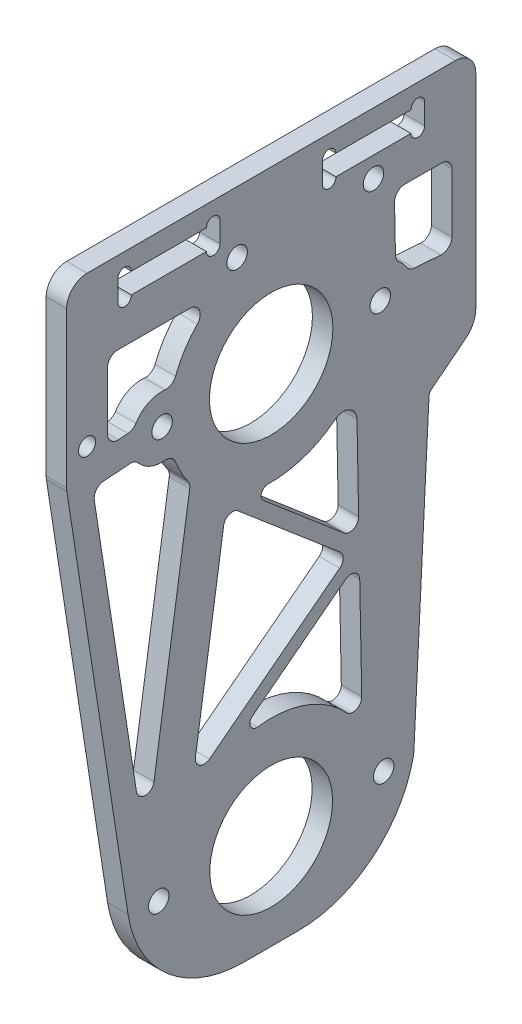
from build123d import *

# Parameters (mm, degrees)
SKETCH_1_W          = 60
SKETCH_1_H          = 96
SKETCH_1_R          = 1.5
SKETCH_1_R_2        = 9
SKETCH_1_R_3        = 9.05
SKETCH_1_H_2        = 3
EXTRUDE_1_DEPTH     = 3
CUT_EXTRUDE_START   = -3
CUT_EXTRUDE_1_DEPTH = 3
SKETCH_3_R          = 1.25
SKETCH_3_R_2        = 1.5
SKETCH_3_W          = 15
SKETCH_3_H          = 3
CUT_EXTRUDE_2_DEPTH = 60.245252974
SKETCH_4_R          = 1
CUT_EXTRUDE_3_DEPTH = 60.245252974
CUT_EXTRUDE_4_DEPTH = 10
CUT_EXTRUDE_5_DEPTH = 60.245252974
EXTRUDE_2_DEPTH     = 3
FILLET_1_R          = 1.3
FILLET_9_R          = 2
FILLET_3_R          = 3
FILLET_4_R          = 1.5
FILLET_5_R          = 4
CUT_EXTRUDE_6_DEPTH = 60.251242528
FILLET_6_R          = 1
FILLET_10_R         = 5


# Read off the part's stored shape, not the designer's step: 切除-拉伸1
with BuildPart() as part:
    # 草图1 → 凸台-拉伸1 (new body)
    # profile 1 of 2: a face of its own
    with BuildSketch(Plane(origin=(0, 0, 0), x_dir=(0, 0, -1), z_dir=(1, 0, 0))):
        Rectangle(SKETCH_1_W, SKETCH_1_H)
        with Locations((16.5, -34)):
            Circle(SKETCH_1_R, mode=Mode.SUBTRACT)
        with Locations((-16.5, -34)):
            Circle(SKETCH_1_R, mode=Mode.SUBTRACT)
        with Locations((16, 26)):
            Circle(SKETCH_1_R, mode=Mode.SUBTRACT)
        with Locations((-16, 26)):
            Circle(SKETCH_1_R, mode=Mode.SUBTRACT)
        with Locations((0, -34)):
            Circle(SKETCH_1_R_2, mode=Mode.SUBTRACT)
        with Locations((0, 26)):
            Circle(SKETCH_1_R_3, mode=Mode.SUBTRACT)
    # profile 2 of 2: a face of its own
    with BuildSketch(Plane(origin=(0, 0, 0), x_dir=(0, 0, -1), z_dir=(1, 0, 0))):
        with Locations((0, 49.5)):
            Rectangle(SKETCH_1_W, SKETCH_1_H_2)
    extrude(amount=EXTRUDE_1_DEPTH)

    # 切除-拉伸1 outline → 切除-拉伸1 (cut)
    with BuildSketch(Plane(origin=(3, 0, 0), x_dir=(0, 0, -1), z_dir=(1, 0, 0)).offset(CUT_EXTRUDE_START)):
        with BuildLine():
            Line((30, -48), (30, 25))
            Line((30, 25), (21, -33.41847233))
            ThreePointArc((21, -33.41847233), (15.198447986, -43.855245061), (4, -48))
            Line((4, -48), (30, -48))
        make_face()
        with BuildLine():
            Line((-30, -48), (-4, -48))
            ThreePointArc((-4, -48), (-15.198447986, -43.855245061), (-21, -33.41847233))
            Line((-21, -33.41847233), (-30, 25))
            Line((-30, 25), (-30, -48))
        make_face()
    extrude(amount=CUT_EXTRUDE_1_DEPTH, mode=Mode.SUBTRACT)

    # 草图3 → 切除-拉伸2 (cut, through all)
    with BuildSketch(Plane(origin=(3, 0, 0), x_dir=(0, 0, -1), z_dir=(1, 0, 0))):
        with Locations((-27, 29)):
            Circle(SKETCH_3_R)
        with Locations((15, 42)):
            Circle(SKETCH_3_R_2)
        with Locations((-5, 42)):
            Circle(SKETCH_3_R_2)
        with Locations((-15, 46.5)):
            Rectangle(SKETCH_3_W, SKETCH_3_H)
        with Locations((15, 46.5)):
            Rectangle(SKETCH_3_W, SKETCH_3_H)
    extrude(amount=-CUT_EXTRUDE_2_DEPTH, mode=Mode.SUBTRACT)

    # 草图4 → 切除-拉伸3 (cut, through all)
    with BuildSketch(Plane(origin=(3, 0, 0), x_dir=(0, 0, -1), z_dir=(1, 0, 0))):
        with Locations((-21.5, 48)):
            Circle(SKETCH_4_R)
        with Locations((-21.5, 45)):
            Circle(SKETCH_4_R)
        with Locations((-8.5, 48)):
            Circle(SKETCH_4_R)
        with Locations((-8.5, 45)):
            Circle(SKETCH_4_R)
        with Locations((8.5, 45)):
            Circle(SKETCH_4_R)
        with Locations((8.5, 48)):
            Circle(SKETCH_4_R)
        with Locations((21.5, 45)):
            Circle(SKETCH_4_R)
        with Locations((21.5, 48)):
            Circle(SKETCH_4_R)
    extrude(amount=-CUT_EXTRUDE_3_DEPTH, mode=Mode.SUBTRACT)

    # 草图6 → 切除-拉伸4 (cut)
    with BuildSketch(Plane(origin=(3, 0, 0), x_dir=(0, 0, -1), z_dir=(1, 0, 0))):
        with BuildLine():
            Line((-18.4613646, -26.910285625), (-11.857625415, 16.731816817))
            ThreePointArc((-11.857625415, 16.731816817), (-13.391258067, 19.13146978), (-14.445390625, 21.777063854))
            ThreePointArc((-14.445390625, 21.777063854), (-17.513828963, 21.762273974), (-19.878390466, 23.71787656))
            Line((-19.878390466, 23.71787656), (-26.191708785, 23.266925251))
            Line((-26.191708785, 23.266925251), (-18.4613646, -26.910285625))
        make_face()
        Polygon((11.318506757, -4.002376427), (-6.62076356, 11.237090825), (-11.596047133, -21.643044091), align=None)
        with BuildLine():
            Line((13.365007146, -27.189964466), (12.932647682, -5.283751611))
            Line((12.932647682, -5.283751611), (-7.478738852, -20.99736699))
            ThreePointArc((-7.478738852, -20.99736699), (4.271897059, -19.621165015), (13.365007146, -27.189964466))
        make_face()
        with BuildLine():
            Line((12.881773753, -2.706139182), (12.481185497, 17.590332433))
            ThreePointArc((12.481185497, 17.590332433), (5.342673899, 11.930233278), (-3.753500841, 11.425579551))
            Line((-3.753500841, 11.425579551), (12.881773753, -2.706139182))
        make_face()
        with BuildLine():
            Line((26.5, 39), (18.059794784, 39))
            Line((18.059794784, 39), (18.239335866, 29.903251834))
            ThreePointArc((18.239335866, 29.903251834), (19.384344521, 28.965840886), (20.163378666, 27.707711359))
            Line((20.163378666, 27.707711359), (26.5, 27.25509555))
            Line((26.5, 27.25509555), (26.5, 39))
        make_face()
        with BuildLine():
            Line((-8.584722927, 38.361433261), (-8.488097697, 39))
            Line((-8.488097697, 39), (-24, 39))
            Line((-24, 39), (-24, 27.433666978))
            Line((-24, 27.433666978), (-20.163378666, 27.707711359))
            ThreePointArc((-20.163378666, 27.707711359), (-17.811907347, 30.119100844), (-14.445390625, 30.222936146))
            ThreePointArc((-14.445390625, 30.222936146), (-12.212915965, 34.794724761), (-8.584722927, 38.361433261))
        make_face()
        with BuildLine():
            ThreePointArc((-8.584722927, 38.361433261), (-8.090184405, 38.690603464), (-7.583040287, 39))
            Line((-7.583040287, 39), (-8.488097697, 39))
            Line((-8.488097697, 39), (-8.584722927, 38.361433261))
        make_face()
    extrude(amount=-CUT_EXTRUDE_4_DEPTH, mode=Mode.SUBTRACT)

    # 草图7 → 切除-拉伸5 (cut, through all)
    with BuildSketch(Plane(origin=(3, 0, 0), x_dir=(0, 0, -1), z_dir=(1, 0, 0))):
        Polygon((28.43912679, 14.868463508), (23.170360519, 10.752052151), (24.727709786, -9.222126667), align=None)
    extrude(amount=-CUT_EXTRUDE_5_DEPTH, mode=Mode.SUBTRACT)

    # 草图8 → 凸台-拉伸2 (add)
    with BuildSketch(Plane(origin=(3, 0, 0), x_dir=(0, 0, -1), z_dir=(1, 0, 0))):
        Polygon((28.43912679, 14.868463508), (30.015148297, 16.099786459), (30, 25), align=None)
    extrude(amount=-EXTRUDE_2_DEPTH)

    # 圆角1
    fillet_1_edges = [part.edges().sort_by_distance(p)[0] for p in [
        (1.5, -2.706139182, -12.881773753),
        (1.5, -4.002376427, -11.318506757),
        (1.5, -21.643044091, 11.596047133),
        (1.5, 11.237090825, 6.62076356),
        (1.5, -27.189964466, -13.365007146),
        (1.5, -5.283751611, -12.932647682),
        (1.5, -26.910285625, 18.4613646),
    ]]
    fillet(fillet_1_edges, radius=FILLET_1_R)

    # 圆角9
    fillet_9_edges = [part.edges().sort_by_distance(p)[0] for p in [
        (1.5, 17.590332433, -12.481185497),
    ]]
    fillet(fillet_9_edges, radius=FILLET_9_R)

    # 圆角3
    fillet_3_edges = [part.edges().sort_by_distance(p)[0] for p in [
        (1.5, 51, 30),
        (1.5, 51, -30),
        (1.5, 25, 30),
    ]]
    fillet(fillet_3_edges, radius=FILLET_3_R)

    # 圆角4
    fillet_4_edges = [part.edges().sort_by_distance(p)[0] for p in [
        (1.5, 27.707711359, -20.163378666),
        (1.5, 29.903251834, -18.239335866),
        (1.5, 39, -18.059794784),
        (1.5, 39, -26.5),
        (1.5, 27.25509555, -26.5),
        (1.5, 30.222936146, 14.445390625),
        (1.5, 27.707711359, 20.163378666),
        (1.5, 27.433666978, 24),
        (1.5, 39, 24),
        (1.5, 39, 7.583040287),
        (1.5, 23.71787656, 19.878390466),
        (1.5, 21.777063854, 14.445390625),
        (1.5, 16.731816817, 11.857625415),
        (1.5, 23.266925251, 26.191708785),
    ]]
    fillet(fillet_4_edges, radius=FILLET_4_R)

    # 圆角5
    fillet_5_edges = [part.edges().sort_by_distance(p)[0] for p in [
        (1.5, 16.099786459, -30.015148297),
    ]]
    fillet(fillet_5_edges, radius=FILLET_5_R)

    # 草图9 → 切除-拉伸6 (cut, through all)
    with BuildSketch(Plane(origin=(3, 0, 0), x_dir=(0, 0, -1), z_dir=(1, 0, 0))):
        Polygon((23.170360519, 10.752052151), (20.910409348, -34), (24.727709786, -9.222126667), align=None)
    extrude(amount=-CUT_EXTRUDE_6_DEPTH, mode=Mode.SUBTRACT)

    # 圆角6
    fillet_6_edges = [part.edges().sort_by_distance(p)[0] for p in [
        (1.5, 11.425579551, 3.753500841),
        (1.5, -20.99736699, 7.478738852),
        (1.5, 10.752052151, -23.170360519),
    ]]
    fillet(fillet_6_edges, radius=FILLET_6_R)

    # 圆角10
    fillet_10_edges = [part.edges().sort_by_distance(p)[0] for p in [
        (1.5, -33.925032861, -20.914195142),
    ]]
    fillet(fillet_10_edges, radius=FILLET_10_R)


solid = part.part
